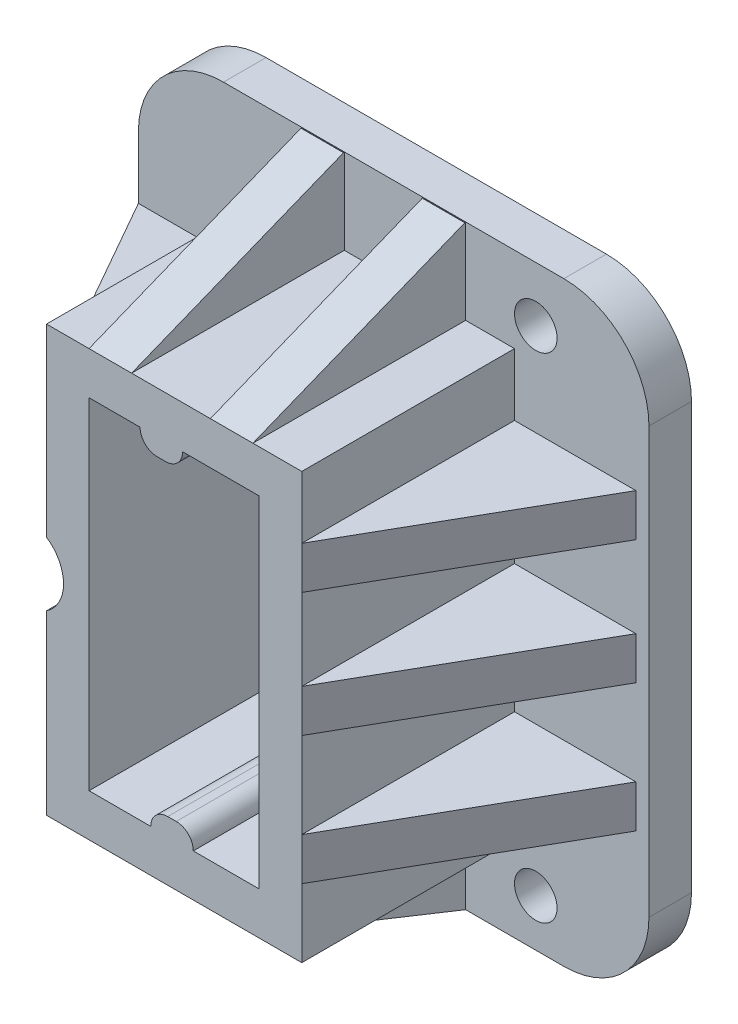
from build123d import *

# Parameters (mm, degrees)
SKETCH1_R                = 2.5
BOSS_EXTRUDE1_DEPTH      = 5
SKETCH3_W                = 20
SKETCH3_H                = 40
BOSS_EXTRUDE5_DEPTH      = 25
CUT_EXTRUDE2_DEPTH       = 75.20598847
CUT_EXTRUDE2_DEPTH_BACK  = 75.20598847
CUT_EXTRUDE_THIN13_DEPTH = 75.484252037
SKETCH8_W                = 5
SKETCH8_H                = 25
BOSS_EXTRUDE6_DEPTH      = 2
FILLET3_R                = 2
SKETCH9_W                = 5
SKETCH9_H                = 25
BOSS_EXTRUDE7_DEPTH      = 2
FILLET4_R                = 2
SKETCH11_R               = 4.5
CUT_EXTRUDE4_DEPTH       = 25


with BuildPart() as part:
    # Sketch1 → Boss-Extrude1 (new body)
    with BuildSketch(Plane.XY):
        with BuildLine():
            Line((-33.639154819, 54.619565217), (6.360845181, 54.619565217))
            ThreePointArc((6.360845181, 54.619565217), (13.431912992, 51.690633029), (16.360845181, 44.619565217))
            Line((16.360845181, 44.619565217), (16.360845181, -5.380434783))
            ThreePointArc((16.360845181, -5.380434783), (13.431912992, -12.451502594), (6.360845181, -15.380434783))
            Line((6.360845181, -15.380434783), (-33.639154819, -15.380434783))
            ThreePointArc((-33.639154819, -15.380434783), (-40.710222631, -12.451502594), (-43.639154819, -5.380434783))
            Line((-43.639154819, -5.380434783), (-43.639154819, 44.619565217))
            ThreePointArc((-43.639154819, 44.619565217), (-40.710222631, 51.690633029), (-33.639154819, 54.619565217))
        make_face()
        with Locations((3.061250856, 48.159869042)):
            Circle(SKETCH1_R, mode=Mode.SUBTRACT)
        with Locations(Location((3.061250856, -9.840130958, 0), (0, 0, 180))):
            Circle(SKETCH1_R, mode=Mode.SUBTRACT)
        with Locations((-31.938749144, 19.159869042)):
            Circle(SKETCH1_R, mode=Mode.SUBTRACT)
    extrude(amount=BOSS_EXTRUDE1_DEPTH)

    # Sketch3 → Boss-Extrude5 (add)
    with BuildSketch(Plane.XY.offset(5)):
        Polygon((-24.438749144, 44.600432852), (-29.438749144, 44.600432852), (-29.438749144, 37.28199121), (-43.639154819, 37.28199121), (-43.639154819, 32.28199121), (-29.438749144, 32.28199121), (-29.438749144, 7.637328911), (-43.639154819, 7.637328911), (-43.639154819, 2.637328911), (-29.438749144, 2.637328911), (-29.438749144, -5.399567148), (-24.438749144, -5.399567148), (-24.438749144, -15.380434783), (-19.438749144, -15.380434783), (-19.438749144, -5.399567148), (-10.184597354, -5.399567148), (-10.184597354, -15.380434783), (-5.184597354, -15.380434783), (-5.184597354, -5.399567148), (0.561250856, -5.399567148), (0.561250856, 2.637328911), (14.825245568, 2.637328911), (14.825245568, 7.637328911), (0.561250856, 7.637328911), (0.561250856, 17.719700958), (14.825245568, 17.719700958), (14.825245568, 22.719700958), (0.561250856, 22.719700958), (0.561250856, 32.28199121), (14.825245568, 32.28199121), (14.825245568, 37.28199121), (0.561250856, 37.28199121), (0.561250856, 44.600432852), (-5.184597354, 44.600432852), (-5.184597354, 54.581300487), (-10.184597354, 54.581300487), (-10.184597354, 44.600432852), (-19.438749144, 44.600432852), (-19.438749144, 54.581300487), (-24.438749144, 54.581300487), align=None)
        with Locations((-14.438749144, 19.600432852)):
            Rectangle(SKETCH3_W, SKETCH3_H, mode=Mode.SUBTRACT)
    extrude(amount=BOSS_EXTRUDE5_DEPTH)

    # Sketch5 → Cut-Extrude2 (cut, two sides: drawn at the far end of the back side and taken through both)
    with BuildSketch(Plane.XZ.offset(-2.637328911).offset(-CUT_EXTRUDE2_DEPTH_BACK)):
        Polygon((-43.639154819, 30), (-43.639154819, 5), (-29.438749144, 30), align=None)
        Polygon((14.825245568, 30), (0.561250856, 30), (14.825245568, 5), align=None)
    extrude(amount=CUT_EXTRUDE2_DEPTH + CUT_EXTRUDE2_DEPTH_BACK, mode=Mode.SUBTRACT)

    # Sketch7 → Cut-Extrude-Thin13 (cut, through all)
    with BuildSketch(Plane.ZY.offset(24.438749144)):
        Polygon((30, 44.600432852), (5, 54.619565217), (8.72002984, 63.901880553), (33.72002984, 53.882748188), align=None)
        Polygon((5, -15.380434783), (30, -5.399567148), (33.707778838, -14.686782882), (8.707778838, -24.667650517), align=None)
    extrude(amount=-CUT_EXTRUDE_THIN13_DEPTH, mode=Mode.SUBTRACT)

    # Sketch8 → Boss-Extrude6 (add)
    with BuildSketch(Plane.XZ.offset(-39.600432852)):
        with Locations((-15.938749144, 17.5)):
            Rectangle(SKETCH8_W, SKETCH8_H)
    extrude(amount=BOSS_EXTRUDE6_DEPTH)

    # Fillet3
    fillet3_edges = [part.edges().sort_by_distance(p)[0] for p in [
        (-18.438749144, 37.600432852, 17.5),
        (-13.438749144, 37.600432852, 17.5),
    ]]
    fillet(fillet3_edges, radius=FILLET3_R - 0.0001)  # a hair under: the kernel refuses the full size

    # Sketch9 → Boss-Extrude7 (add)
    with BuildSketch(Plane(origin=(0, -0.399567148, 0), x_dir=(1, 0, 0), z_dir=(0, 1, 0))):
        with Locations((-14.690486301, -17.5)):
            Rectangle(SKETCH9_W, SKETCH9_H)
    extrude(amount=BOSS_EXTRUDE7_DEPTH)

    # Fillet4
    fillet4_edges = [part.edges().sort_by_distance(p)[0] for p in [
        (-12.190486301, 1.600432852, 17.5),
        (-17.190486301, 1.600432852, 17.5),
    ]]
    fillet(fillet4_edges, radius=FILLET4_R - 0.0001)  # a hair under: the kernel refuses the full size

    # Sketch11 → Cut-Extrude4 (cut)
    with BuildSketch(Plane.XY.offset(30)):
        with Locations((-31.938749144, 19.159869042)):
            Circle(SKETCH11_R)
    extrude(amount=-CUT_EXTRUDE4_DEPTH, mode=Mode.SUBTRACT)


solid = part.part
